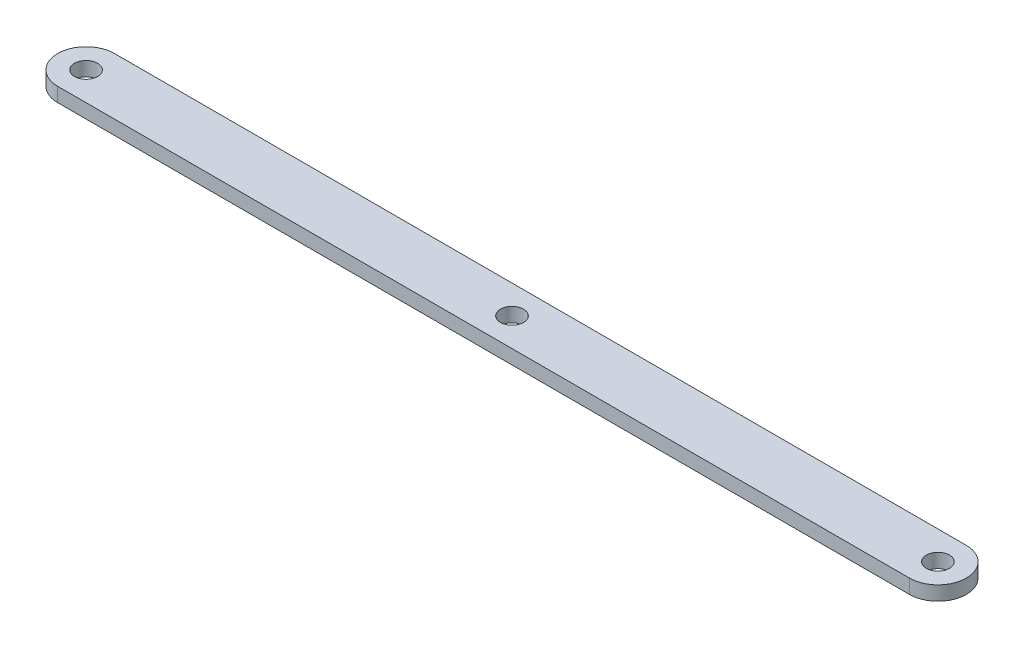
from build123d import *

# Parameters (mm, degrees)
SKETCH1_R           = 2.5796875
BOSS_EXTRUDE1_DEPTH = 3.175


with BuildPart() as part:
    # Sketch1 → Boss-Extrude1 (new body)
    with BuildSketch(Plane(origin=(0, 0, 0), x_dir=(1, 0, 0), z_dir=(0, 1, 0))):
        with BuildLine():
            Line((-95.25, 6.35), (95.25, 6.35))
            ThreePointArc((95.25, 6.35), (101.6, 0), (95.25, -6.35))
            Line((95.25, -6.35), (-95.25, -6.35))
            ThreePointArc((-95.25, -6.35), (-101.6, 0), (-95.25, 6.35))
        make_face()
        with Locations((95.25, 0)):
            Circle(SKETCH1_R, mode=Mode.SUBTRACT)
        with Locations((-95.25, 0)):
            Circle(SKETCH1_R, mode=Mode.SUBTRACT)
        Circle(SKETCH1_R, mode=Mode.SUBTRACT)
    extrude(amount=BOSS_EXTRUDE1_DEPTH)


solid = part.part
